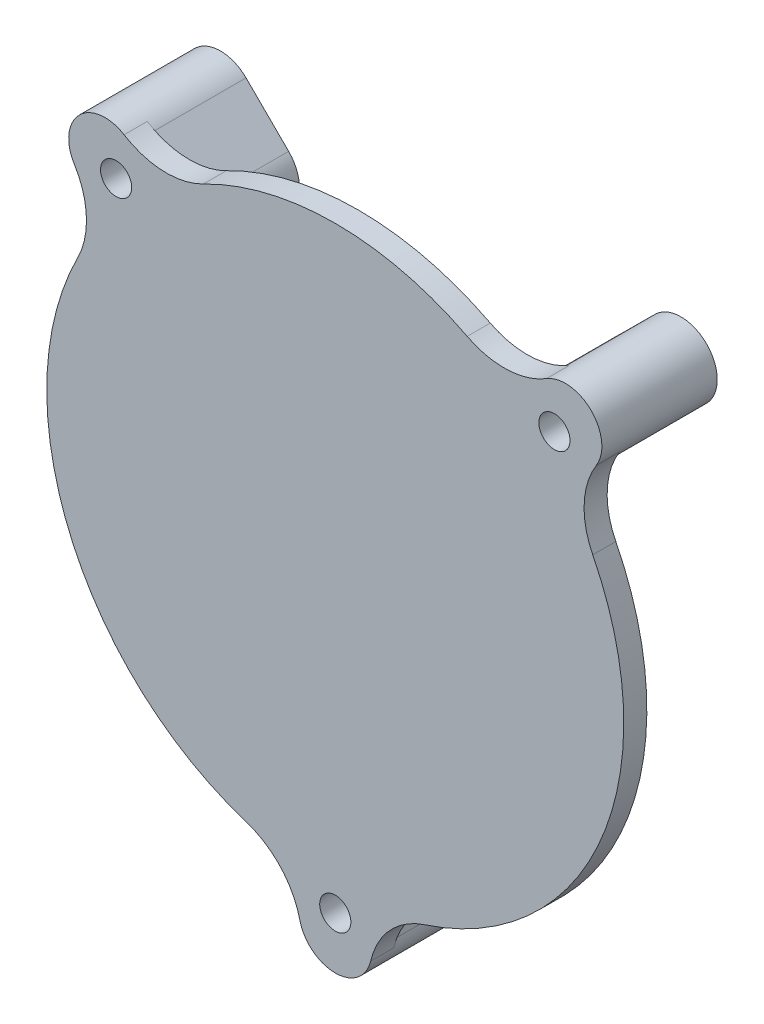
from build123d import *

# Parameters (mm, degrees)
SKETCH1_R           = 1.35
BOSS_EXTRUDE1_DEPTH = 10
SKETCH2_R           = 25
BOSS_EXTRUDE2_DEPTH = 2
CIRPATTERN1_COUNT   = 2
CIRPATTERN1_ANGLE   = 134.8
CIRPATTERN2_COUNT   = 2
CIRPATTERN2_ANGLE   = 225.2
FILLET1_R           = 7


with BuildPart() as part:
    # Sketch1 → Boss-Extrude1 (new body)
    with BuildSketch(Plane.XY):
        with BuildLine():
            Line((3.15, 3.85), (3.15, -1.35))
            ThreePointArc((3.15, -1.35), (0, -4.5), (-3.15, -1.35))
            Line((-3.15, -1.35), (-3.15, 3.85))
            ThreePointArc((-3.15, 3.85), (0, 7), (3.15, 3.85))
        make_face()
        Circle(SKETCH1_R, mode=Mode.SUBTRACT)
    boss_extrude1 = extrude(amount=BOSS_EXTRUDE1_DEPTH)

    # Sketch2 → Boss-Extrude2 (add)
    with BuildSketch(Plane.XY.offset(10)):
        with Locations((0, 26.766568047)):
            Circle(SKETCH2_R)
    extrude(amount=-BOSS_EXTRUDE2_DEPTH)

    # CirPattern1: Boss-Extrude1 ×2 about axis
    cirpattern1_axis = Axis((0, 26.766568047, 0), (0, 0, 1))
    for i in range(1, CIRPATTERN1_COUNT):
        add(boss_extrude1.rotate(cirpattern1_axis, i * CIRPATTERN1_ANGLE / (CIRPATTERN1_COUNT - 1)))

    # CirPattern2: Boss-Extrude1 ×2 about axis
    cirpattern2_axis = Axis((0, 26.766568047, 0), (0, 0, 1))
    for i in range(1, CIRPATTERN2_COUNT):
        add(boss_extrude1.rotate(cirpattern2_axis, i * CIRPATTERN2_ANGLE / (CIRPATTERN2_COUNT - 1)))

    # Fillet1
    # the kernel refuses this fillet: 7 mm, written as the material it adds along each edge
    with BuildSketch(Plane(origin=(-19.817488489, 42.006881364, 8), x_dir=(-0.53269115848809, -0.8463097126162599, 0), z_dir=(0, 0, 1))) as fillet1_piece_1:
        with BuildLine():
            CenterArc((5.338447362, -6.96923168), FILLET1_R, 95.374025281, 58.803015478)
            Line((-0.962562709, -3.920088835), (-1.592663716, -3.61517455))
            ThreePointArc((-1.592663716, -3.61517455), (-1.407138142, -3.082948514), (-0.683108314, 0.152849703))
            Line((-0.683108314, 0.152849703), (0.06555988, 0.696923168))
            ThreePointArc((0.06555988, 0.696923168), (2.341424281, 0.590113144), (4.617288683, 0.696923168))
            Line((4.617288683, 0.696923168), (4.682848563, 0))
        make_face()
    extrude(amount=2)
    with BuildSketch(Plane(origin=(-15.378292966, 46.477177004, 8), x_dir=(0.8425702330097088, 0.5385864855767968, 0), z_dir=(0, 0, 1)), Plane(origin=(19.817488489, 42.006881364, 8), x_dir=(0.532691158488102, -0.8463097126162524, 0), z_dir=(0, 0, 1))) as fillet1_piece_2:
        with BuildLine():
            CenterArc((5.338447362, 6.96923168), FILLET1_R, 205.822959241, 58.803015478)
            Line((-0.962562709, 3.920088835), (-1.592663716, 3.61517455))
            ThreePointArc((-1.592663716, 3.61517455), (-1.407138142, 3.082948514), (-0.683108314, -0.152849703))
            Line((-0.683108314, -0.152849703), (0.06555988, -0.696923168))
            ThreePointArc((0.06555988, -0.696923168), (2.341424281, -0.590113144), (4.617288683, -0.696923168))
            Line((4.617288683, -0.696923168), (4.682848563, 0))
        make_face()
    extrude(amount=2)
    with BuildSketch(Plane(origin=(15.378292966, 46.477177004, 8), x_dir=(0.7239706283099918, 0.6898307976195582, 0), z_dir=(0, 0, 1)), Plane(origin=(3.15, 1.96581201, 8), x_dir=(-0.020650724563576823, -0.9997867510499423, 0), z_dir=(0, 0, 1))) as fillet1_piece_3:
        with BuildLine():
            CenterArc((5.495161337, 6.846342989), FILLET1_R, 199.169842212, 58.803015478)
            Line((-1.116684038, 4.547756306), (-1.777868575, 4.317897638))
            ThreePointArc((-1.777868575, 4.317897638), (-1.131431398, 2.133158264), (-0.692451691, -0.102521492))
            Line((-0.692451691, -0.102521492), (0.014455507, -0.699850726))
            ThreePointArc((0.014455507, -0.699850726), (3.329560424, -0.631376805), (3.890673543, -0.684634299))
            Line((3.890673543, -0.684634299), (4.03653607, 0))
        make_face()
    extrude(amount=2)
    with BuildSketch(Plane(origin=(-3.15, 1.96581201, 8), x_dir=(0.020650724563576386, -0.9997867510499423, 0), z_dir=(0, 0, 1))) as fillet1_piece_4:
        with BuildLine():
            CenterArc((5.495161337, -6.846342989), FILLET1_R, 102.02714231, 58.803015478)
            Line((-1.116684038, -4.547756306), (-1.777868575, -4.317897638))
            ThreePointArc((-1.777868575, -4.317897638), (-1.131431398, -2.133158264), (-0.692451691, 0.102521492))
            Line((-0.692451691, 0.102521492), (0.014455507, 0.699850726))
            ThreePointArc((0.014455507, 0.699850726), (3.329560424, 0.631376805), (3.890673543, 0.684634299))
            Line((3.890673543, 0.684634299), (4.03653607, 0))
        make_face()
    extrude(amount=2)


solid = part.part
